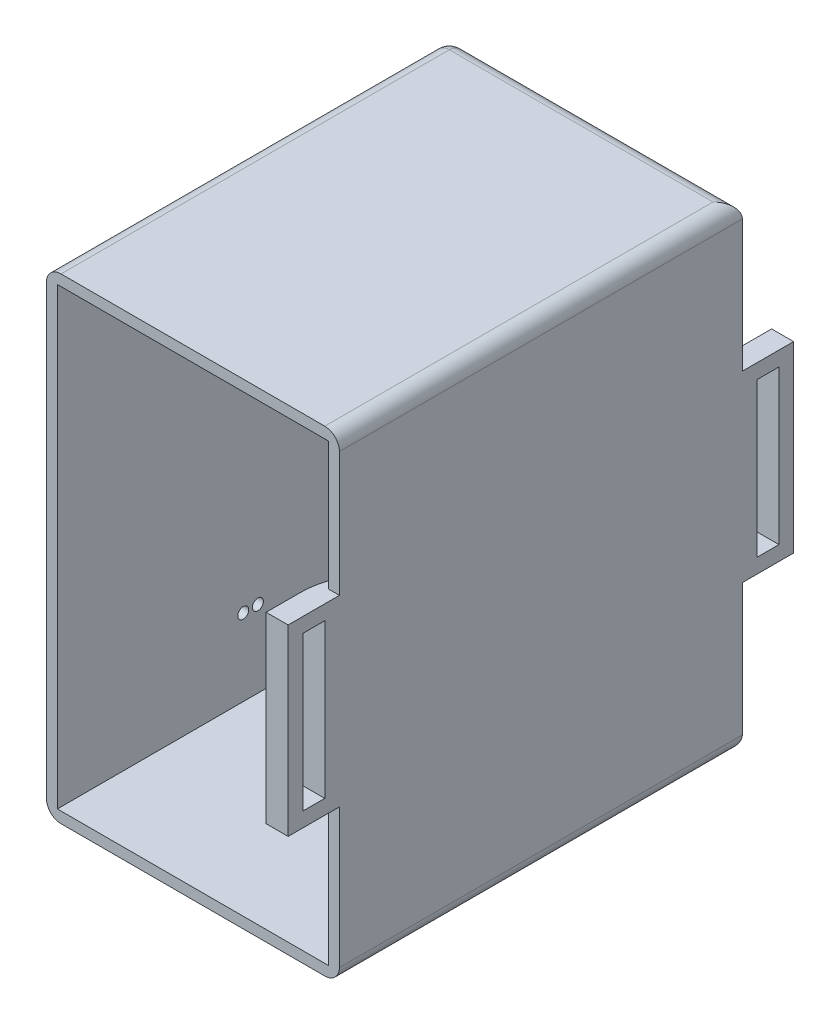
from build123d import *

# Parameters (mm, degrees)
SKETCH1_W           = 55
SKETCH1_H           = 65
BOSS_EXTRUDE1_DEPTH = 40
SKETCH2_W           = 37
SKETCH2_H           = 62
CUT_EXTRUDE1_DEPTH  = 53.5
FILLET1_R           = 2
FILLET7_R           = 2
BOSS_EXTRUDE2_DEPTH = 2
SKETCH17_R          = 0.75
CUT_EXTRUDE3_DEPTH  = 3.5
SKETCH18_W          = 3
SKETCH18_H          = 25
BOSS_EXTRUDE3_DEPTH = 7
SKETCH19_W          = 3
SKETCH19_H          = 25
BOSS_EXTRUDE4_DEPTH = 7
SKETCH22_W          = 3
SKETCH22_H          = 25
BOSS_EXTRUDE5_DEPTH = 1.5
SKETCH23_W          = 3
SKETCH23_H          = 21
CUT_EXTRUDE4_DEPTH  = 3
FILLET9_R           = 10
SKETCH24_W          = 3
SKETCH24_H          = 20
CUT_EXTRUDE5_DEPTH  = 5


with BuildPart() as part:
    # Sketch1 → Boss-Extrude1 (new body)
    with BuildSketch(Plane(origin=(0, 0, 0), x_dir=(0, 0, -1), z_dir=(1, 0, 0))):
        with Locations((12.658301158, -7.783783784)):
            Rectangle(SKETCH1_W, SKETCH1_H)
    extrude(amount=BOSS_EXTRUDE1_DEPTH)

    # Sketch2 → Cut-Extrude1 (cut)
    with BuildSketch(Plane.XY.offset(14.841698842)):
        with Locations((20, -7.783783784)):
            Rectangle(SKETCH2_W, SKETCH2_H)
    extrude(amount=-CUT_EXTRUDE1_DEPTH, mode=Mode.SUBTRACT)

    # Fillet1
    fillet1_edges = [part.edges().sort_by_distance(p)[0] for p in [
        (40, 24.716216216, -12.658301158),
        (0, -7.783783784, -40.158301158),
        (0, -40.283783784, -12.658301158),
        (20, 24.716216216, -40.158301158),
        (20, -40.283783784, -40.158301158),
        (40, -40.283783784, -12.658301158),
    ]]
    fillet(fillet1_edges, radius=FILLET1_R)

    # Fillet7
    # the kernel refuses this fillet: 2 mm, written as the material it takes off along each edge
    with BuildSketch(Plane(origin=(2, 22.716216216, -38.158301158), x_dir=(-1, 0, 0), z_dir=(0, 1, 0))) as fillet7_piece_1_section:
        Polygon((0, 0), (FILLET7_R, 0), (FILLET7_R, -FILLET7_R), (0, -FILLET7_R), align=None)
    fillet7_piece_1 = extrude(amount=FILLET7_R, mode=Mode.PRIVATE)
    fillet7_piece_1 = fillet7_piece_1 - Plane(origin=(2, 22.716216216, -38.158301158), x_dir=(0.7071067811865475, 0, 0.7071067811865475), z_dir=(0, 1, 0)) * Sphere(FILLET7_R, mode=Mode.PRIVATE)
    add(fillet7_piece_1, mode=Mode.SUBTRACT)
    with BuildSketch(Plane(origin=(0, 24.716216216, 19.841698842), x_dir=(1, 0, 0), z_dir=(0, 0, -1))) as fillet7_piece_2:
        with BuildLine():
            CenterArc((FILLET7_R, FILLET7_R), FILLET7_R, 180, 90)
            Line((0, FILLET7_R), (0, 0))
            Line((0, 0), (FILLET7_R, 0))
        make_face()
    extrude(amount=58, mode=Mode.SUBTRACT)

    # Sketch16 → Boss-Extrude2 (add)
    with BuildSketch(Plane.ZY):
        with BuildLine():
            ThreePointArc((-5.736624698, 17.653603477), (-12.555029292, 21.251157673), (-19.459260578, 17.82119736))
            ThreePointArc((-19.459260578, 17.82119736), (-22.577953623, 10.406366019), (-24.332801521, 2.556112585))
            ThreePointArc((-24.332801521, 2.556112585), (-24.205542572, -2.611001185), (-22.077609894, -7.321326234))
            ThreePointArc((-22.077609894, -7.321326234), (-19.565557127, -13.10020976), (-20.565766521, -19.321583006))
            ThreePointArc((-20.565766521, -19.321583006), (-21.037839736, -25.044648424), (-19.459260578, -30.565918092))
            ThreePointArc((-19.459260578, -30.565918092), (-10.406141283, -35.070804577), (-2.644818813, -28.588918684))
            ThreePointArc((-2.644818813, -28.588918684), (-2.212041027, -23.266864026), (-3.652018787, -18.125071882))
            ThreePointArc((-3.652018787, -18.125071882), (-4.916354141, -12.558379885), (-2.644818813, -7.321326234))
            ThreePointArc((-2.644818813, -7.321326234), (-1.085145754, -3.293973241), (-0.88318994, 1.020116006))
            ThreePointArc((-0.88318994, 1.020116006), (-2.121330664, 9.683670911), (-5.736624698, 17.653603477))
        make_face()
    extrude(amount=BOSS_EXTRUDE2_DEPTH)

    # Sketch17 → Cut-Extrude3 (cut)
    with BuildSketch(Plane.ZY.offset(2)):
        with Locations((-15.44953453, 14.297400207)):
            Circle(SKETCH17_R)
        with Locations((-13.44953453, 14.297400207)):
            Circle(SKETCH17_R)
        with Locations((-4.229257303, 6.228419053)):
            Circle(SKETCH17_R)
        with Locations((-6.229257303, 6.228419053)):
            Circle(SKETCH17_R)
        with Locations((-20.261021777, -0.629536007)):
            Circle(SKETCH17_R)
        with Locations((-18.261021777, -0.629536007)):
            Circle(SKETCH17_R)
        with Locations((-12.530672595, -28.291294223)):
            Circle(SKETCH17_R)
        with Locations((-10.530672595, -28.291294223)):
            Circle(SKETCH17_R)
    extrude(amount=-CUT_EXTRUDE3_DEPTH, mode=Mode.SUBTRACT)

    # Sketch18 → Boss-Extrude3 (add)
    with BuildSketch(Plane(origin=(0, 0, -40.158301158), x_dir=(-1, 0, 0), z_dir=(0, 0, -1))):
        with Locations((-38.5, -7.783783784)):
            Rectangle(SKETCH18_W, SKETCH18_H)
    extrude(amount=BOSS_EXTRUDE3_DEPTH)

    # Sketch19 → Boss-Extrude4 (add)
    with BuildSketch(Plane.XY.offset(14.841698842)):
        with Locations((38.5, -6.783783784)):
            Rectangle(SKETCH19_W, SKETCH19_H)
    extrude(amount=BOSS_EXTRUDE4_DEPTH)

    # Sketch22 → Boss-Extrude5 (add)
    with BuildSketch(Plane.ZY.offset(-38.5)):
        with Locations((13.341698842, -6.783783784)):
            Rectangle(SKETCH22_W, SKETCH22_H)
    extrude(amount=BOSS_EXTRUDE5_DEPTH)

    # Sketch23 → Cut-Extrude4 (cut)
    with BuildSketch(Plane.ZY.offset(-37)):
        with Locations((-43.658301158, -7.783783784)):
            Rectangle(SKETCH23_W, SKETCH23_H)
        with Locations((18.341698842, -6.783783784)):
            Rectangle(SKETCH23_W, SKETCH23_H)
    extrude(amount=-CUT_EXTRUDE4_DEPTH, mode=Mode.SUBTRACT)

    # Fillet9
    # the kernel refuses this fillet: 10 mm, written as the material it takes off along each edge
    with BuildSketch(Plane(origin=(37, 18.885783407, 11.841698842), x_dir=(0, 0, 1), z_dir=(0, -1, 0))) as fillet9_piece_1:
        with BuildLine():
            CenterArc((5.267826876, -10), FILLET9_R, 90, 31.788330617)
            Line((0, -1.5), (-0.105356538, -1.33))
            ThreePointArc((-0.105356538, -1.33), (-0.2, -0.75), (-0.2, 0))
            Line((-0.2, 0), (0, 0.2))
            Line((0, 0.2), (5.267826876, 0.2))
            Line((5.267826876, 0.2), (5.267826876, 0))
        make_face()
    extrude(amount=51.339134382, mode=Mode.SUBTRACT)

    # Sketch24 → Cut-Extrude5 (cut)
    with BuildSketch(Plane.XZ.offset(40.283783784)):
        with Locations((37, -12.658301158)):
            Rectangle(SKETCH24_W, SKETCH24_H)
    extrude(amount=-CUT_EXTRUDE5_DEPTH, mode=Mode.SUBTRACT)


solid = part.part
